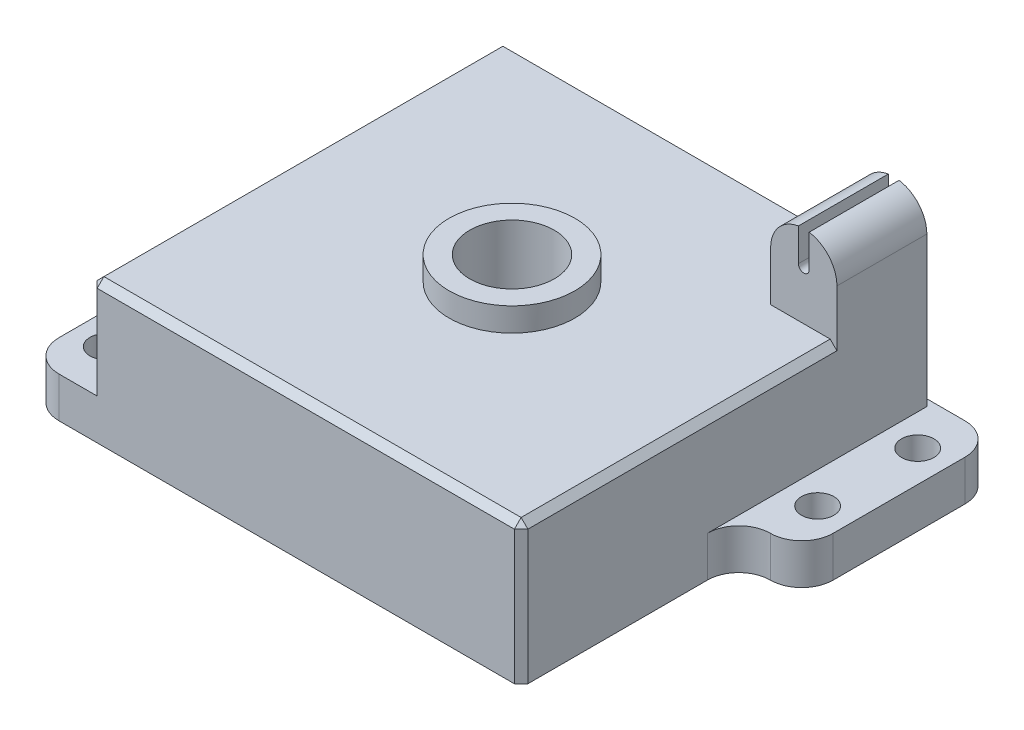
from build123d import *

# Parameters (mm, degrees)
ESBO_O1_R                = 2.4
RESSALTO_EXTRUS_O1_DEPTH = 6
ESBO_O2_W                = 63.7
ESBO_O2_H                = 61
RESSALTO_EXTRUS_O2_DEPTH = 14.8
CHANFRO1_SIZE            = 1
ESBO_O3_R                = 6.25
CORTE_EXTRUS_O1_DEPTH    = 16.8
FILETE1_R                = 4.65
RESSALTO_EXTRUS_O4_DEPTH = 13.3
RESSALTO_EXTRUS_O5_START = -2.2
RESSALTO_EXTRUS_O5_DEPTH = 2.2
RESSALTO_EXTRUS_O6_START = 2.2
RESSALTO_EXTRUS_O6_DEPTH = 2.2
RESSALTO_EXTRUS_O7_START = 3.5
ESBO_O7_R                = 9.3
ESBO_O7_R_2              = 6.25
RESSALTO_EXTRUS_O7_DEPTH = 3.5


with BuildPart() as part:
    # Esboço1 → Ressalto-extrusão1 (new body)
    with BuildSketch(Plane(origin=(0, 0, 0), x_dir=(1, 0, 0), z_dir=(0, 1, 0))):
        Polygon((-41.15, -1.7), (-31.85, -1.7), (-31.85, 30.5), (41.15, 30.5), (41.15, 1.7), (31.85, 1.7), (31.85, -30.5), (-41.15, -30.5), align=None)
        with Locations(Location((-36.5, -8.7, 0), (0, 0, 270))):
            Circle(ESBO_O1_R, mode=Mode.SUBTRACT)
        with Locations(Location((-36.5, -23.5, 0), (0, 0, 270))):
            Circle(ESBO_O1_R, mode=Mode.SUBTRACT)
        with Locations(Location((36.5, 8.7, 0), (0, 0, 270))):
            Circle(ESBO_O1_R, mode=Mode.SUBTRACT)
        with Locations(Location((36.5, 23.5, 0), (0, 0, 270))):
            Circle(ESBO_O1_R, mode=Mode.SUBTRACT)
    extrude(amount=RESSALTO_EXTRUS_O1_DEPTH)

    # Esboço2 → Ressalto-extrusão2 (add)
    with BuildSketch(Plane(origin=(0, 6, 0), x_dir=(1, 0, 0), z_dir=(0, 1, 0))):
        Rectangle(ESBO_O2_W, ESBO_O2_H)
    extrude(amount=RESSALTO_EXTRUS_O2_DEPTH)

    # Chanfro1
    chanfro1_edges = [part.edges().sort_by_distance(p)[0] for p in [
        (31.85, 10.4, 30.5),
        (-31.85, 10.4, -30.5),
        (0, 20.8, -30.5),
        (31.85, 13.4, -30.5),
        (31.85, 20.8, 0),
        (0, 20.8, 30.5),
        (-31.85, 13.4, 30.5),
        (-31.85, 20.8, 0),
    ]]
    chamfer(chanfro1_edges, length=CHANFRO1_SIZE)

    # Esboço3 → Corte-extrusão1 (cut)
    with BuildSketch(Plane(origin=(0, 20.8, 0), x_dir=(1, 0, 0), z_dir=(0, 1, 0))):
        with Locations(Location((0, 0, 0), (0, 0, 270))):
            Circle(ESBO_O3_R)
    extrude(amount=-CORTE_EXTRUS_O1_DEPTH, mode=Mode.SUBTRACT)

    # Filete1
    filete1_edges = [part.edges().sort_by_distance(p)[0] for p in [
        (41.15, 3, -30.5),
        (41.15, 3, -1.7),
        (31.85, 3, -1.7),
        (-31.85, 3, 1.7),
        (-41.15, 3, 1.7),
        (-41.15, 3, 30.5),
    ]]
    fillet(filete1_edges, radius=FILETE1_R - 0.0001)  # a hair under: the kernel refuses the full size

    # Esboço4 → Ressalto-extrusão4 (add)
    with BuildSketch(Plane(origin=(0, 0, -29.5), x_dir=(-1, 0, 0), z_dir=(0, 0, -1))):
        with BuildLine():
            Line((-31.85, 19.8), (-22.05, 19.8))
            Line((-22.05, 19.8), (-22.05, 28.1))
            ThreePointArc((-22.05, 28.1), (-23.213022612, 31.269384798), (-26.15, 32.934252786))
            Line((-26.15, 32.934252786), (-26.15, 30.783281573))
            ThreePointArc((-26.15, 30.783281573), (-26.95, 25.3), (-27.75, 30.783281573))
            Line((-27.75, 30.783281573), (-27.75, 32.934252786))
            ThreePointArc((-27.75, 32.934252786), (-30.686977388, 31.269384798), (-31.85, 28.1))
            Line((-31.85, 28.1), (-31.85, 19.8))
        make_face()
    extrude(amount=-RESSALTO_EXTRUS_O4_DEPTH)

    # Esboço5 → Ressalto-extrusão5 (add)
    with BuildSketch(Plane.XY.offset(-16.2).offset(RESSALTO_EXTRUS_O5_START)):
        with BuildLine():
            Line((26.15, 30.783281573), (26.15, 28.1))
            ThreePointArc((26.15, 28.1), (26.95, 27.3), (27.75, 28.1))
            Line((27.75, 28.1), (27.75, 30.783281573))
            ThreePointArc((27.75, 30.783281573), (26.95, 25.3), (26.15, 30.783281573))
        make_face()
    extrude(amount=RESSALTO_EXTRUS_O5_DEPTH)

    # Esboço6 → Ressalto-extrusão6 (add)
    with BuildSketch(Plane(origin=(0, 4, 0), x_dir=(1, 0, 0), z_dir=(0, 1, 0)).offset(RESSALTO_EXTRUS_O6_START)):
        with BuildLine():
            Line((-3.011276291, -4.300548233), (-3.584852727, -5.119700277))
            ThreePointArc((-3.584852727, -5.119700277), (0, 6.25), (3.584852727, -5.119700277))
            Line((3.584852727, -5.119700277), (3.011276291, -4.300548233))
            ThreePointArc((3.011276291, -4.300548233), (0, 5.25), (-3.011276291, -4.300548233))
        make_face()
    extrude(amount=-RESSALTO_EXTRUS_O6_DEPTH)

    # Esboço7 → Ressalto-extrusão7 (add)
    with BuildSketch(Plane(origin=(0, 20.8, 0), x_dir=(1, 0, 0), z_dir=(0, 1, 0)).offset(RESSALTO_EXTRUS_O7_START)):
        with Locations(Location((0, 0, 0), (0, 0, 90))):
            Circle(ESBO_O7_R)
        with Locations(Location((0, 0, 0), (0, 0, 270))):
            Circle(ESBO_O7_R_2, mode=Mode.SUBTRACT)
    extrude(amount=-RESSALTO_EXTRUS_O7_DEPTH)


solid = part.part
